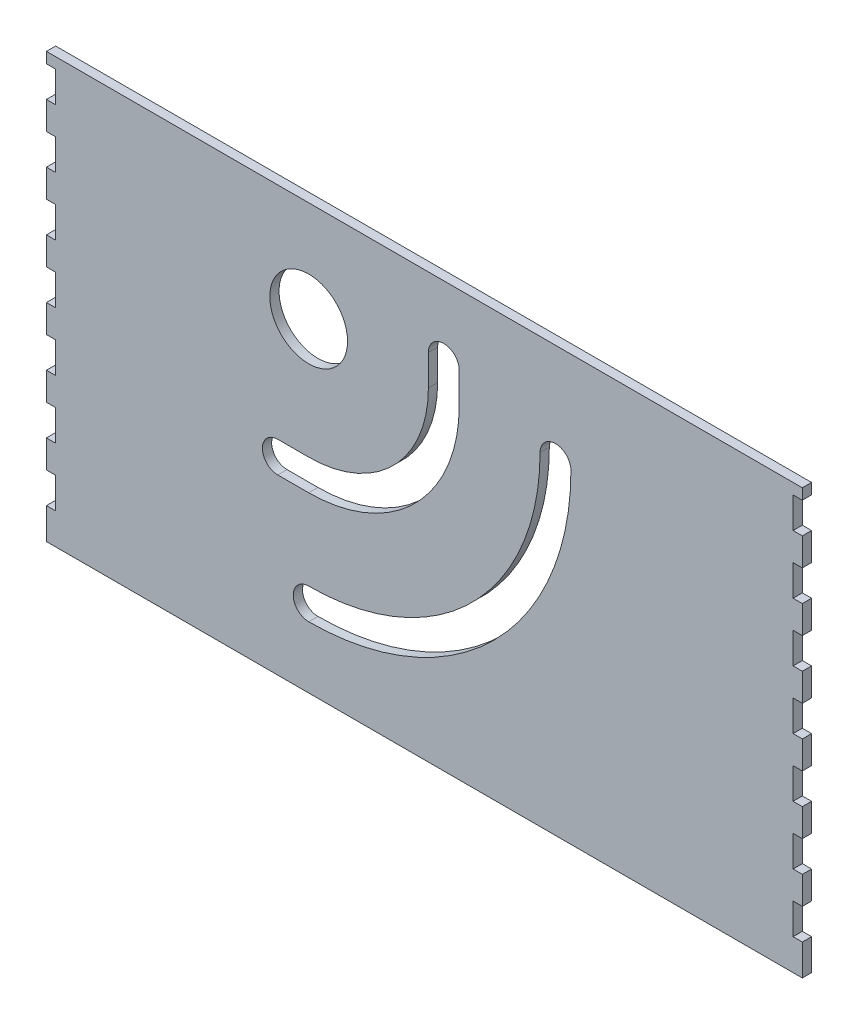
from build123d import *

# Parameters (mm, degrees)
SKETCH1_R           = 12.6
BOSS_EXTRUDE1_DEPTH = 3


with BuildPart() as part:
    # Sketch1 → Boss-Extrude1 (new body)
    with BuildSketch(Plane.XY):
        Polygon((244.5, 137.6), (244.5, 134.1), (241.5, 134.1), (241.5, 124.1), (244.5, 124.1), (244.5, 115.1), (241.5, 115.1), (241.5, 105.1), (244.5, 105.1), (244.5, 96.1), (241.5, 96.1), (241.5, 86.1), (244.5, 86.1), (244.5, 77.1), (241.5, 77.1), (241.5, 67.1), (244.5, 67.1), (244.5, 58.1), (241.5, 58.1), (241.5, 48.1), (244.5, 48.1), (244.5, 39.1), (241.5, 39.1), (241.5, 29.1), (244.5, 29.1), (244.5, 20.1), (241.5, 20.1), (241.5, 10.1), (244.5, 10.1), (244.5, 0), (-0.5, 0), (-0.5, 10.1), (2.5, 10.1), (2.5, 20.1), (-0.5, 20.1), (-0.5, 29.1), (2.5, 29.1), (2.5, 39.1), (-0.5, 39.1), (-0.5, 48.1), (2.5, 48.1), (2.5, 58.1), (-0.5, 58.1), (-0.5, 67.1), (2.5, 67.1), (2.5, 77.1), (-0.5, 77.1), (-0.5, 86.1), (2.5, 86.1), (2.5, 96.1), (-0.5, 96.1), (-0.5, 105.1), (2.5, 105.1), (2.5, 115.1), (-0.5, 115.1), (-0.5, 124.1), (2.5, 124.1), (2.5, 134.1), (-0.5, 134.1), (-0.5, 137.6), align=None)
        with Locations((84.5, 105)):
            Circle(SKETCH1_R, mode=Mode.SUBTRACT)
        with BuildLine():
            Line((123.3, 105), (123.3, 115))
            ThreePointArc((123.3, 115), (128.3, 120), (133.3, 115))
            Line((133.3, 115), (133.3, 105))
            ThreePointArc((133.3, 105), (119.006810922, 70.493189078), (84.5, 56.2))
            Line((84.5, 56.2), (74.5, 56.2))
            ThreePointArc((74.5, 56.2), (69.5, 61.2), (74.5, 66.2))
            Line((74.5, 66.2), (84.5, 66.2))
            ThreePointArc((84.5, 66.2), (111.93574311, 77.56425689), (123.3, 105))
        make_face(mode=Mode.SUBTRACT)
        with BuildLine():
            ThreePointArc((169.5, 105), (164.5, 110), (159.5, 105))
            ThreePointArc((159.5, 105), (137.533008589, 51.966991411), (84.5, 30))
            ThreePointArc((84.5, 30), (79.5, 25), (84.5, 20))
            ThreePointArc((84.5, 20), (144.604076401, 44.895923599), (169.5, 105))
        make_face(mode=Mode.SUBTRACT)
    extrude(amount=BOSS_EXTRUDE1_DEPTH)


solid = part.part
